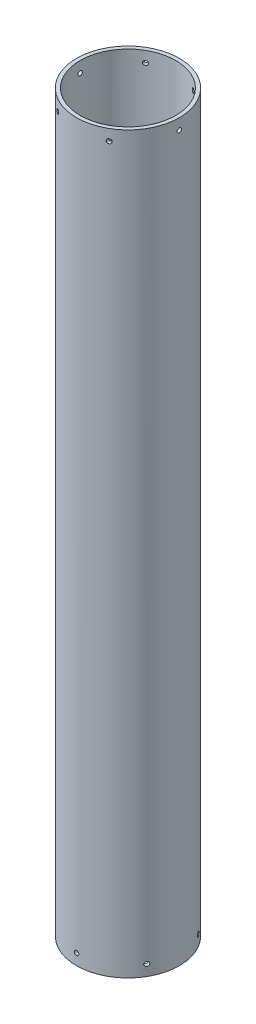
from build123d import *

# Parameters (mm, degrees)
SKETCH1_R           = 70
SKETCH1_R_2         = 65
BOSS_EXTRUDE1_DEPTH = 1000
CUT_EXTRUDE1_REACH  = 1006.888
SKETCH2_R           = 3.05
CIRPATTERN1_COUNT   = 6
SKETCH3_R           = 3.05
CUT_EXTRUDE2_DEPTH  = 1005.88805358
CIRPATTERN2_COUNT   = 6


with BuildPart() as part:
    # Sketch1 → Boss-Extrude1 (new body)
    with BuildSketch(Plane(origin=(0, 0, 0), x_dir=(1, 0, 0), z_dir=(0, 1, 0))):
        Circle(SKETCH1_R)
        Circle(SKETCH1_R_2, mode=Mode.SUBTRACT)
    extrude(amount=BOSS_EXTRUDE1_DEPTH)

    # Sketch2 → Cut-Extrude1 (cut, up to next)
    with BuildSketch(Plane(origin=(0, 0, 0), x_dir=(0, 0, -1), z_dir=(1, 0, 0)), mode=Mode.PRIVATE) as cut_extrude1_sk1:
        with Locations((0, 985)):
            Circle(SKETCH2_R)
    cut_extrude1_tool1 = extrude(cut_extrude1_sk1.sketch, amount=-CUT_EXTRUDE1_REACH, mode=Mode.PRIVATE) & part.part
    cut_extrude1 = cut_extrude1_tool1.solids().sort_by_distance((0, 985, 0))[0]
    add(cut_extrude1, mode=Mode.SUBTRACT)

    # CirPattern1: Cut-Extrude1 ×6 about axis
    cirpattern1_axis = Axis((0, 1000, 0), (0, 1, 0))
    for i in range(1, CIRPATTERN1_COUNT):
        add(cut_extrude1.rotate(cirpattern1_axis, i * 360 / CIRPATTERN1_COUNT), mode=Mode.SUBTRACT)

    # Sketch3 → Cut-Extrude2 (cut, through all)
    with BuildSketch(Plane.XY):
        with Locations((0, 15)):
            Circle(SKETCH3_R)
    cut_extrude2 = extrude(amount=-CUT_EXTRUDE2_DEPTH, mode=Mode.SUBTRACT)

    # CirPattern2: Cut-Extrude2 ×6 about axis
    cirpattern2_axis = Axis((0, 0, 0), (0, 1, 0))
    for i in range(1, CIRPATTERN2_COUNT):
        add(cut_extrude2.rotate(cirpattern2_axis, i * 360 / CIRPATTERN2_COUNT), mode=Mode.SUBTRACT)


solid = part.part
